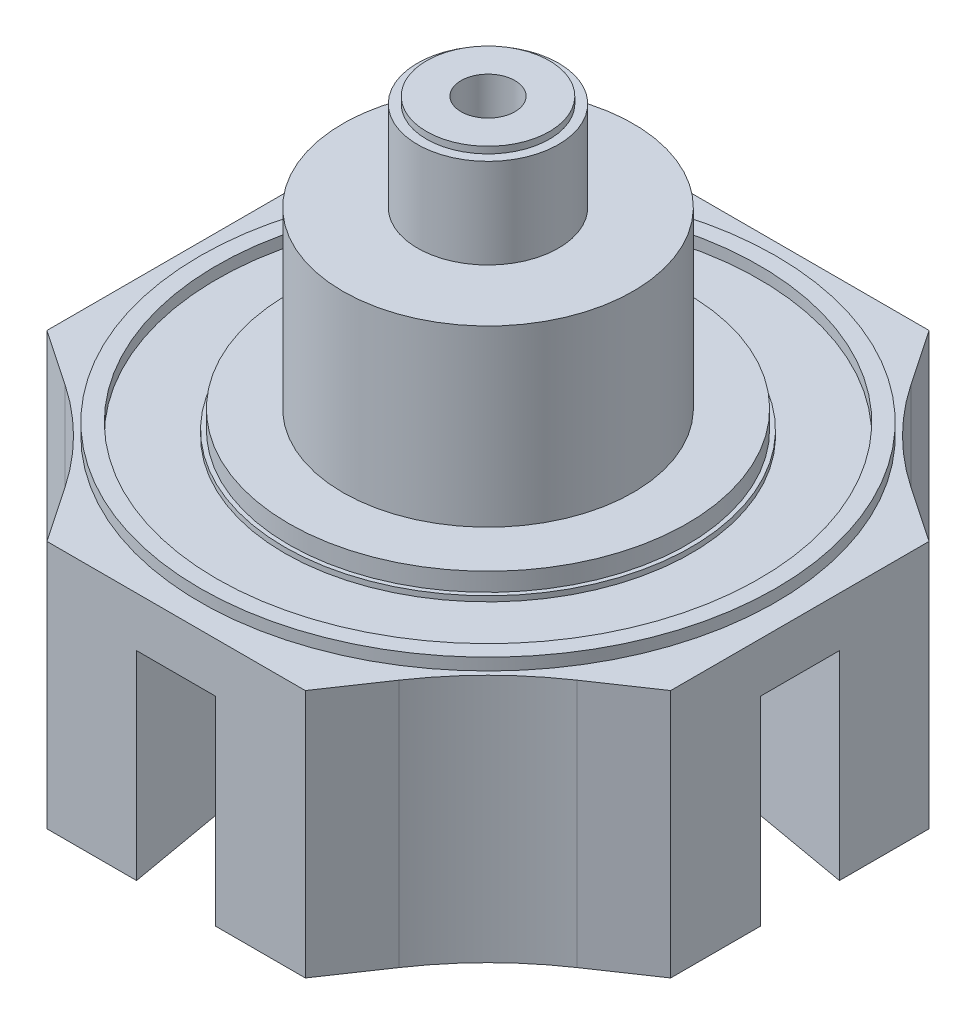
from build123d import *

# Parameters (mm, degrees)
BASE_DEPTH                = 38.1
DOVETAIL_CUTS_DEPTH       = 30.48
SKETCH3_R                 = 31.115
LOWER_WASHER_LIP_DEPTH    = 0.8128
SKETCH4_R                 = 44.069
SKETCH4_R_2               = 41.529
RETAINING_LIP_DEPTH       = 1.8288
SKETCH6_R                 = 30.48
UPPER_BEARING_LIP_DEPTH   = 2.797175
SKETCH7_R                 = 22.225
CENTRAL_SHAFT_DEPTH       = 26.67
SKETCH5_R                 = 7.62
NUT_CLEARANCE_SHAFT_DEPTH = 44.45
SKETCH8_R                 = 10.795
THROUGH_SHAFT_DEPTH       = 14.7574
SKETCH9_R                 = 4.1275
THROUGH_HOLE_DEPTH        = 108.091797456
NUT_SLOT_DEPTH            = 5.6007
UPPER_START               = -1.016
SKETCH11_R                = 10.795
SKETCH11_R_2              = 9.398
UPPER_WASHER_LIP_DEPTH    = 1.016
FILLET2_R                 = 50.8


with BuildPart() as part:
    # Sketch1 → Base (new body)
    with BuildSketch(Plane(origin=(0, 0, 0), x_dir=(1, 0, 0), z_dir=(0, 1, 0))):
        Polygon((-47.732745366, -19.7715505), (-47.732745366, 19.7715505), (-31.058071097, 31.058071097), (-19.7715505, 47.732745366), (19.7715505, 47.732745366), (31.058071097, 31.058071097), (47.732745366, 19.7715505), (47.732745366, -19.7715505), (31.058071097, -31.058071097), (19.7715505, -47.732745366), (-19.7715505, -47.732745366), (-31.058071097, -31.058071097), align=None)
    extrude(amount=BASE_DEPTH)

    # Sketch2 → Dovetail cuts (cut)
    with BuildSketch(Plane.XZ):
        Polygon((6.055553628, -47.732745366), (-6.055553628, -47.732745366), (-11.43, -17.252745366), (11.43, -17.252745366), align=None)
        Polygon((-17.252745366, -11.43), (-17.252745366, 11.43), (-47.732745366, 6.055553628), (-47.732745366, -6.055553628), align=None)
        Polygon((17.252745366, 11.43), (17.252745366, -11.43), (47.732745366, -6.055553628), (47.732745366, 6.055553628), align=None)
        Polygon((6.055553628, 47.732745366), (11.43, 17.252745366), (-11.43, 17.252745366), (-6.055553628, 47.732745366), align=None)
    extrude(amount=-DOVETAIL_CUTS_DEPTH, mode=Mode.SUBTRACT)

    # Sketch3 → Lower washer lip (add)
    with BuildSketch(Plane(origin=(0, 38.1, 0), x_dir=(1, 0, 0), z_dir=(0, 1, 0))):
        with Locations(Location((0, 0, 0), (0, 0, 270))):
            Circle(SKETCH3_R)
    extrude(amount=LOWER_WASHER_LIP_DEPTH)

    # Sketch4 → Retaining lip (add)
    with BuildSketch(Plane(origin=(0, 38.1, 0), x_dir=(1, 0, 0), z_dir=(0, 1, 0))):
        with Locations(Location((0, 0, 0), (0, 0, 45.946261879))):
            Circle(SKETCH4_R)
        with Locations(Location((0, 0, 0), (0, 0, 270))):
            Circle(SKETCH4_R_2, mode=Mode.SUBTRACT)
    extrude(amount=RETAINING_LIP_DEPTH)

    # Sketch6 → Upper bearing lip (add)
    with BuildSketch(Plane(origin=(0, 38.9128, 0), x_dir=(1, 0, 0), z_dir=(0, 1, 0))):
        with Locations(Location((0, 0, 0), (0, 0, 270))):
            Circle(SKETCH6_R)
    extrude(amount=UPPER_BEARING_LIP_DEPTH)

    # Sketch7 → Central shaft (add)
    with BuildSketch(Plane(origin=(0, 41.709975, 0), x_dir=(1, 0, 0), z_dir=(0, 1, 0))):
        with Locations(Location((0, 0, 0), (0, 0, 270))):
            Circle(SKETCH7_R)
    extrude(amount=CENTRAL_SHAFT_DEPTH)

    # Sketch5 → Nut clearance shaft (cut)
    with BuildSketch(Plane.XZ):
        with Locations(Location((0, 0, 0), (0, 0, 270))):
            Circle(SKETCH5_R)
    extrude(amount=-NUT_CLEARANCE_SHAFT_DEPTH, mode=Mode.SUBTRACT)

    # Sketch8 → Through Shaft (add)
    with BuildSketch(Plane(origin=(0, 68.379975, 0), x_dir=(1, 0, 0), z_dir=(0, 1, 0))):
        with Locations(Location((0, 0, 0), (0, 0, 90))):
            Circle(SKETCH8_R)
    extrude(amount=THROUGH_SHAFT_DEPTH)

    # Sketch9 → Through Hole (cut, through all)
    with BuildSketch(Plane(origin=(0, 83.137375, 0), x_dir=(1, 0, 0), z_dir=(0, 1, 0))):
        with Locations(Location((0, 0, 0), (0, 0, 270))):
            Circle(SKETCH9_R)
    extrude(amount=-THROUGH_HOLE_DEPTH, mode=Mode.SUBTRACT)

    # Sketch10 → Nut slot (cut)
    with BuildSketch(Plane.XZ.offset(-44.45)):
        Polygon((3.287458414, 5.694045), (6.574916827, 0), (3.287458414, -5.694045), (-3.287458414, -5.694045), (-6.574916827, 0), (-3.287458414, 5.694045), align=None)
    extrude(amount=-NUT_SLOT_DEPTH, mode=Mode.SUBTRACT)

    # Sketch11 → Upper washer lip (cut)
    with BuildSketch(Plane(origin=(0, 83.137375, 0), x_dir=(1, 0, 0), z_dir=(0, 1, 0)).offset(UPPER_START)):
        with Locations(Location((0, 0, 0), (0, 0, 90))):
            Circle(SKETCH11_R)
        with Locations(Location((0, 0, 0), (0, 0, 270))):
            Circle(SKETCH11_R_2, mode=Mode.SUBTRACT)
    extrude(amount=UPPER_WASHER_LIP_DEPTH, mode=Mode.SUBTRACT)

    # Fillet2
    # the kernel refuses this fillet: 50.8 mm, written as the material it adds along each edge
    with BuildSketch(Plane(origin=(-31.058071097, 0, 31.058071097), x_dir=(-0.8281314013708309, 0, -0.5605340150816753), z_dir=(0, 1, 0)), Plane(origin=(31.058071097, 0, 31.058071097), x_dir=(-0.5605340150816742, 0, 0.8281314013708316), z_dir=(0, 1, 0))) as fillet2_piece_1:
        with BuildLine():
            CenterArc((FILLET2_R * 0.192701123769, FILLET2_R), FILLET2_R, 248.185472983, 21.814527017)
            Line((-FILLET2_R * 0.178902112104, FILLET2_R * 0.0716083611488), (0, 0))
            Line((0, 0), (FILLET2_R * 0.192701123769, 0))
        make_face()
    extrude(amount=38.1)
    with BuildSketch(Plane(origin=(-31.058071097, 0, -31.058071097), x_dir=(-0.8281314013708309, 0, 0.5605340150816753), z_dir=(0, 1, 0)), Plane(origin=(31.058071097, 0, -31.058071097), x_dir=(-0.5605340150816742, 0, -0.8281314013708316), z_dir=(0, 1, 0))) as fillet2_piece_2:
        with BuildLine():
            CenterArc((FILLET2_R * 0.192701123769, -FILLET2_R), FILLET2_R, 90, 21.814527017)
            Line((-FILLET2_R * 0.178902112104, -FILLET2_R * 0.0716083611488), (0, 0))
            Line((0, 0), (FILLET2_R * 0.192701123769, 0))
        make_face()
    extrude(amount=38.1)


solid = part.part
